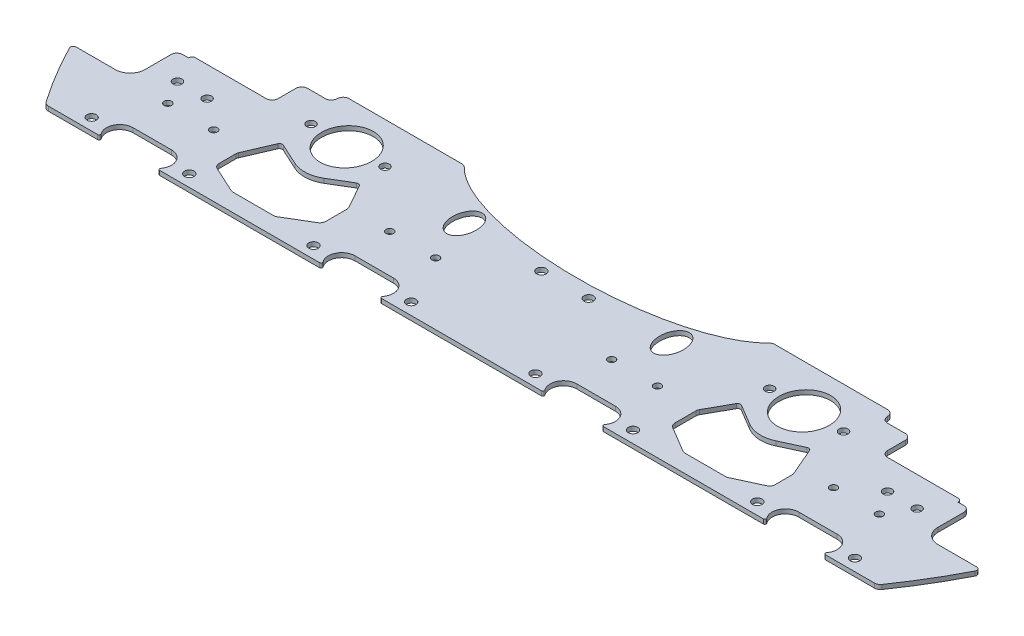
from build123d import *

# Parameters (mm, degrees)
T_LE_DE_BASE_PLI_E1_DEPTH = 1.5
CONG_1_R                  = 5
ESQUISSE2_W               = 103
ESQUISSE2_H               = 14
PATTE1_DEPTH              = 1.5
ESQUISSE5_R               = 1.5
ESQUISSE5_RX              = 9
ESQUISSE5_RY              = 8.5
ESQUISSE5_RX_2            = 6
ESQUISSE5_RY_2            = 4
ESQUISSE5_W               = 10
ESQUISSE5_H               = 4
ESQUISSE5_W_2             = 4
ESQUISSE5_H_2             = 1.2
ENL_V_MAT_EXTRU_1_DEPTH   = 1.5
ENL_V_MAT_EXTRU_3_DEPTH   = 169.577133681
CONG_2_R                  = 1
CONG_3_R                  = 2
ESQUISSE6_R               = 1.25
ESQUISSE6_R_2             = 1.5
ENL_V_MAT_EXTRU_2_DEPTH   = 1.5
CONG_5_R                  = 0.5
ESQUISSE11_R              = 1.6
ESQUISSE11_RX             = 54.51081151
ESQUISSE11_RY             = 20
ENL_V_MAT_EXTRU_4_DEPTH   = 169.004757327
CONG_4_R                  = 2


# Sheet-metal steps are written as plain solids
with BuildPart() as part:
    # Esquisse1 → Tôle de base pliée1 (new body)
    with BuildSketch(Plane(origin=(0, 0, 0), x_dir=(1, 0, 0), z_dir=(0, 1, 0))):
        with BuildLine():
            Line((0, 55), (-134, 55))
            Line((-134, 55), (-134, 38))
            Line((-134, 38), (-153.801820535, 38))
            ThreePointArc((-153.801820535, 38), (-147.637295096, 26.754721957), (-140.652052953, 16))
            Line((-140.652052953, 16), (0, 16))
            Line((0, 16), (0, 55))
        make_face()
    extrude(amount=-T_LE_DE_BASE_PLI_E1_DEPTH)

    # Congé1
    cong_1_edges = [part.edges().sort_by_distance(p)[0] for p in [
        (-134, -0.75, -38),
    ]]
    fillet(cong_1_edges, radius=CONG_1_R)

    # Esquisse2 → Patte1 (add)
    with BuildSketch(Plane(origin=(0, 0, 0), x_dir=(1, 0, 0), z_dir=(0, 1, 0))):
        with Locations((-51.5, 62)):
            Rectangle(ESQUISSE2_W, ESQUISSE2_H)
    extrude(amount=-PATTE1_DEPTH)

    # Esquisse5 → Enlèv. mat.-Extru.1 (cut)
    with BuildSketch(Plane(origin=(0, 0, 0), x_dir=(1, 0, 0), z_dir=(0, 1, 0))):
        with Locations(Location((-125, 45, 0), (0, 0, 270))):
            Circle(ESQUISSE5_R)
        with Locations(Location((-115, 45, 0), (0, 0, 90))):
            Circle(ESQUISSE5_R)
        with Locations(Location((-77.3, 54.5), (0, 0, 90))):
            Ellipse(ESQUISSE5_RX, ESQUISSE5_RY)
        with Locations(Location((-35, 52), (0, 0, -90))):
            Ellipse(ESQUISSE5_RX_2, ESQUISSE5_RY_2)
        with Locations((-98, 67)):
            Rectangle(ESQUISSE5_W, ESQUISSE5_H)
        with Locations((-132, 54.4)):
            Rectangle(ESQUISSE5_W_2, ESQUISSE5_H_2)
    extrude(amount=-ENL_V_MAT_EXTRU_1_DEPTH, mode=Mode.SUBTRACT)

    # Esquisse7 → Enlèv. mat.-Extru.3 (cut, through all)
    with BuildSketch(Plane.XZ.offset(1.5)):
        with BuildLine():
            Line((-94, -26.776862841), (-94, -34.127707598))
            Line((-94, -34.127707598), (-89.445593183, -44.717925725))
            Line((-89.445593183, -44.717925725), (-81.281078387, -40.954617932))
            ThreePointArc((-81.281078387, -40.954617932), (-76.561125557, -40.050559309), (-71.964476608, -41.452734458))
            Line((-71.964476608, -41.452734458), (-64.210600306, -46.087357996))
            Line((-64.210600306, -46.087357996), (-59, -36.743965137))
            Line((-59, -36.743965137), (-59, -27.99850523))
            Line((-59, -27.99850523), (-69.035694847, -22))
            Line((-69.035694847, -22), (-83.636572532, -22))
            Line((-83.636572532, -22), (-94, -26.776862841))
        make_face()
    extrude(amount=-ENL_V_MAT_EXTRU_3_DEPTH, mode=Mode.SUBTRACT)

    # Congé2
    cong_2_edges = [part.edges().sort_by_distance(p)[0] for p in [
        (-153.801820535, -0.75, -38),
        (-64.210600306, -0.75, -46.087357996),
        (-89.445593183, -0.75, -44.717925725),
        (-130, -0.75, -55),
    ]]
    fillet(cong_2_edges, radius=CONG_2_R)

    # Congé3
    cong_3_edges = [part.edges().sort_by_distance(p)[0] for p in [
        (-134, -0.75, -53.8),
        (-93, -0.75, -69),
        (-93, -0.75, -65),
        (-103, -0.75, -65),
        (-103, -0.75, -55),
        (-140.652052953, -0.75, -16),
        (-59, -0.75, -36.743965137),
        (-59, -0.75, -27.99850523),
        (-69.035694847, -0.75, -22),
        (-83.636572532, -0.75, -22),
        (-94, -0.75, -26.776862841),
        (-94, -0.75, -34.127707598),
    ]]
    fillet(cong_3_edges, radius=CONG_3_R - 0.0001)  # a hair under: the kernel refuses the full size

    # Esquisse6 → Enlèv. mat.-Extru.2 (cut)
    with BuildSketch(Plane(origin=(0, 0, 0), x_dir=(1, 0, 0), z_dir=(0, 1, 0))):
        with Locations(Location((-120.25, 37, 0), (0, 0, 270))):
            Circle(ESQUISSE6_R)
        with Locations(Location((-104.75, 37, 0), (0, 0, 270))):
            Circle(ESQUISSE6_R)
        with Locations(Location((-45.25, 37, 0), (0, 0, 270))):
            Circle(ESQUISSE6_R)
        with Locations(Location((-29.75, 37, 0), (0, 0, 270))):
            Circle(ESQUISSE6_R)
        with Locations(Location((-90, 55.15, 0), (0, 0, 270))):
            Circle(ESQUISSE6_R_2)
        with Locations(Location((-65, 55.15, 0), (0, 0, 270))):
            Circle(ESQUISSE6_R_2)
        with BuildLine():
            Line((-119, 24), (-106, 24))
            ThreePointArc((-106, 24), (-101.5, 19.5), (-106, 15))
            Line((-106, 15), (-119, 15))
            ThreePointArc((-119, 15), (-123.5, 19.5), (-119, 24))
        make_face()
        with BuildLine():
            Line((-44, 24), (-31, 24))
            ThreePointArc((-31, 24), (-26.5, 19.5), (-31, 15))
            Line((-31, 15), (-44, 15))
            ThreePointArc((-44, 15), (-48.5, 19.5), (-44, 24))
        make_face()
    extrude(amount=-ENL_V_MAT_EXTRU_2_DEPTH, mode=Mode.SUBTRACT)

    # Congé5
    cong_5_edges = [part.edges().sort_by_distance(p)[0] for p in [
        (-28.171572875, -0.75, -16),
        (-46.828427125, -0.75, -16),
        (-103.171572875, -0.75, -16),
        (-121.828427125, -0.75, -16),
    ]]
    fillet(cong_5_edges, radius=CONG_5_R)

    # Symétrie1: part across face


with BuildPart() as part_1:
    add(part.part)
    add(part.part.mirror(Plane(origin=(0, -0.75, -42.5), x_dir=(0, 0, 1), z_dir=(1, 0, 0))))

    # Esquisse11 → Enlèv. mat.-Extru.4 (cut, through all)
    with BuildSketch(Plane(origin=(0, 0, 0), x_dir=(1, 0, 0), z_dir=(0, 1, 0))):
        with Locations(Location((-8, 51, 0), (0, 0, 270))):
            Circle(ESQUISSE11_R)
        with Locations(Location((8, 51, 0), (0, 0, 270))):
            Circle(ESQUISSE11_R)
        with Locations(Location((-129, 20, 0), (0, 0, 270))):
            Circle(ESQUISSE11_R)
        with Locations(Location((-21, 20, 0), (0, 0, 270))):
            Circle(ESQUISSE11_R)
        with Locations(Location((21, 20, 0), (0, 0, 270))):
            Circle(ESQUISSE11_R)
        with Locations(Location((129, 20, 0), (0, 0, 270))):
            Circle(ESQUISSE11_R)
        with Locations(Location((-96, 20, 0), (0, 0, 270))):
            Circle(ESQUISSE11_R)
        with Locations(Location((-54, 20, 0), (0, 0, 270))):
            Circle(ESQUISSE11_R)
        with Locations(Location((54, 20, 0), (0, 0, 270))):
            Circle(ESQUISSE11_R)
        with Locations(Location((96, 20, 0), (0, 0, 270))):
            Circle(ESQUISSE11_R)
        with Locations((0, 75)):
            Ellipse(ESQUISSE11_RX, ESQUISSE11_RY)
    extrude(amount=-ENL_V_MAT_EXTRU_4_DEPTH, mode=Mode.SUBTRACT)

    # Congé4
    cong_4_edges = [part_1.edges().sort_by_distance(p)[0] for p in [
        (52, -0.75, -69),
        (-52, -0.75, -69),
    ]]
    fillet(cong_4_edges, radius=CONG_4_R)


solid = part_1.part
